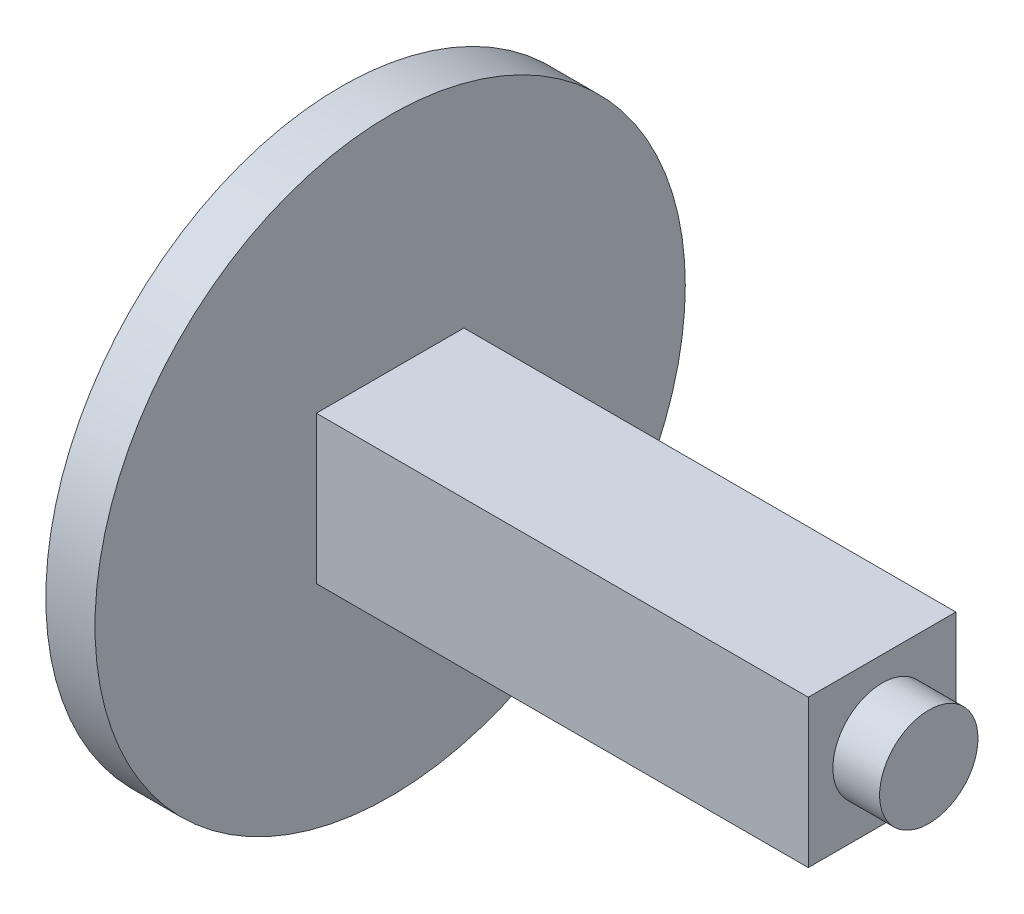
from build123d import *

# Parameters (mm, degrees)
ESQUISSE1_R        = 600
BOSS_EXTRU_1_DEPTH = 100
ESQUISSE2_W        = 300
ESQUISSE2_H        = 300
BOSS_EXTRU_2_DEPTH = 1000
ESQUISSE3_R        = 100
BOSS_EXTRU_3_DEPTH = 95


with BuildPart() as part:
    # Esquisse1 → Boss.-Extru.1 (new body)
    with BuildSketch(Plane(origin=(0, 0, 0), x_dir=(0, 0, -1), z_dir=(1, 0, 0))):
        Circle(ESQUISSE1_R)
    extrude(amount=BOSS_EXTRU_1_DEPTH)

    # Esquisse2 → Boss.-Extru.2 (add)
    with BuildSketch(Plane(origin=(100, 0, 0), x_dir=(0, 0, -1), z_dir=(1, 0, 0))):
        Rectangle(ESQUISSE2_W, ESQUISSE2_H)
    extrude(amount=BOSS_EXTRU_2_DEPTH)

    # Esquisse3 → Boss.-Extru.3 (add)
    with BuildSketch(Plane(origin=(1100, 0, 0), x_dir=(0, 0, -1), z_dir=(1, 0, 0))):
        Circle(ESQUISSE3_R)
    extrude(amount=BOSS_EXTRU_3_DEPTH)


solid = part.part
